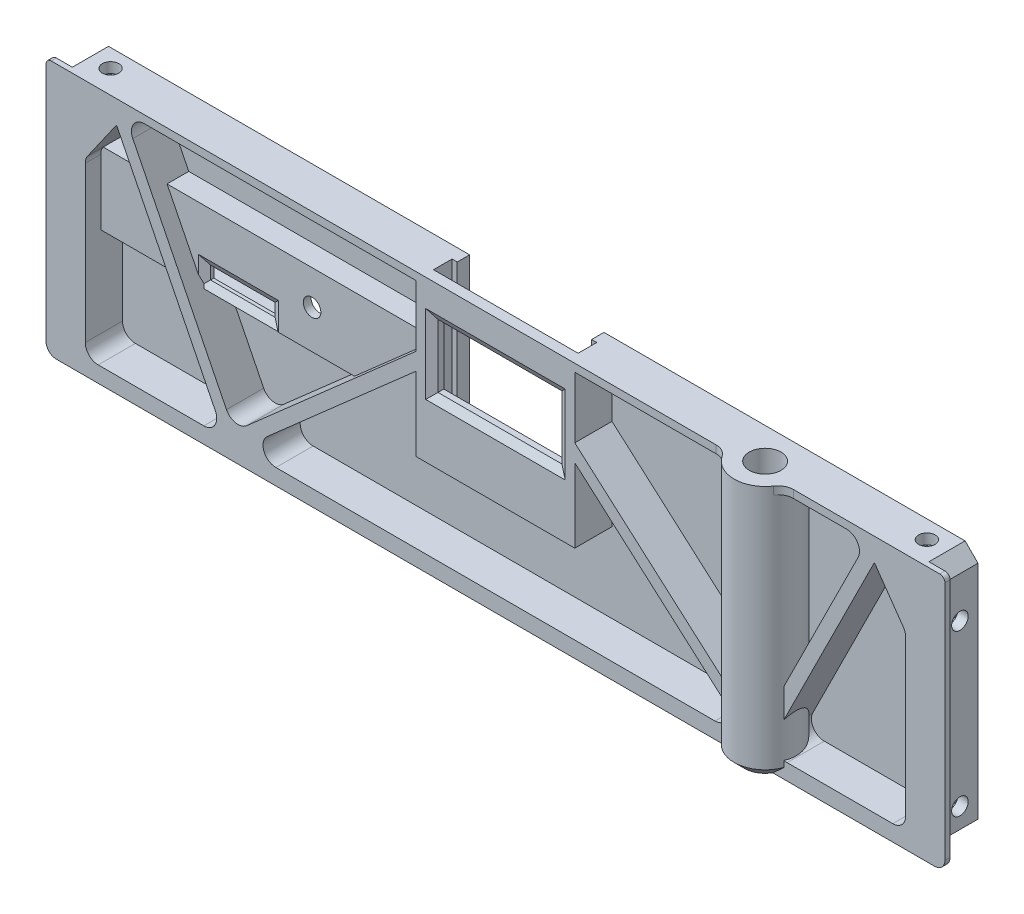
from build123d import *

# Parameters (mm, degrees)
SKETCH1_W                 = 174
SKETCH1_H                 = 51.1
BOSS_EXTRUDE1_DEPTH       = 8
SKETCH2_OUTSIDE_W         = 212.304
SKETCH2_OUTSIDE_H         = 89.404
SKETCH2_OUTSIDE_W_2       = 170.8
SKETCH2_OUTSIDE_H_2       = 47.9
CUT_EXTRUDE1_DEPTH        = 7
CHAMFER1_SIZE             = 2.5
FILLET1_R                 = 2
SKETCH3_W                 = 158.8
SKETCH3_H                 = 44.9
CUT_EXTRUDE2_DEPTH        = 7.2
BOSS_EXTRUDE2_DEPTH       = 7.2
F_3_0MM_DOWEL_HOLE1_D     = 3.2
F_3_0MM_DOWEL_HOLE1_DEPTH = 5
F_3_0MM_DOWEL_HOLE2_D     = 3.2
F_3_0MM_DOWEL_HOLE2_DEPTH = 5
CUT_EXTRUDE3_START        = -2
SKETCH10_W                = 6.25
SKETCH10_H                = 5.5
CUT_EXTRUDE3_DEPTH        = 1.8
CUT_EXTRUDE4_START        = -2
SKETCH11_W                = 5.5
SKETCH11_H                = 6.25
CUT_EXTRUDE4_DEPTH        = 1.8
BOSS_EXTRUDE3_DEPTH       = 7.2
SMALL_FIX_DEPTH           = 7.2
FILLET2_R                 = 2.5
FILLET3_R                 = 0.1
SKETCH14_W                = 30.7
SKETCH14_H                = 31
BOSS_EXTRUDE4_DEPTH       = 8
SKETCH17_W                = 28
SKETCH17_H                = 3.6
CUT_EXTRUDE6_DEPTH        = 29.5
SKETCH18_W                = 26
SKETCH18_H                = 26.5
CUT_EXTRUDE7_DEPTH        = 6
SKETCH19_W                = 24
SKETCH19_H                = 12.25
CUT_EXTRUDE8_DEPTH        = 2
CHAMFER2_SIZE             = 1.5
CHAMFER2_SIZE2            = 0.866025404
SKETCH21_W                = 174
SKETCH21_H                = 1.6
CUT_EXTRUDE10_DEPTH       = 91.94395252
BOSS_EXTRUDE5_START       = -3
BOSS_EXTRUDE5_DEPTH       = 4.2
SKETCH23_W                = 59
SKETCH23_H                = 9.6
CUT_EXTRUDE11_DEPTH       = 3.5
SKETCH25_W                = 35
SKETCH25_H                = 2.5
CUT_EXTRUDE12_DEPTH       = 3.5
SKETCH26_W                = 5
SKETCH26_H                = 7.4
SKETCH26_W_2              = 7
BOSS_EXTRUDE6_DEPTH       = 3.5
SKETCH27_R                = 1.7
SKETCH27_W                = 12.5
SKETCH27_H                = 2.5
CUT_EXTRUDE13_DEPTH       = 1.5
FILLET4_R                 = 1
BOSS_EXTRUDE8_REACH       = 102.415
SKETCH29_R                = 6
SKETCH30_R                = 3.075
CUT_EXTRUDE14_DEPTH       = 43.9
SKETCH31_W                = 12
SKETCH31_H                = 7
CUT_EXTRUDE15_DEPTH       = 1.6
CHAMFER3_SIZE             = 2
FILLET5_R                 = 3
SKETCH32_W                = 5.5
SKETCH32_H                = 1.8
SKETCH32_W_2              = 1.8
SKETCH32_H_2              = 5.5
CUT_EXTRUDE17_DEPTH       = 0.1


with BuildPart() as part:
    # Sketch1 → Boss-Extrude1 (new body)
    with BuildSketch(Plane.XY):
        Rectangle(SKETCH1_W, SKETCH1_H)
    extrude(amount=-BOSS_EXTRUDE1_DEPTH)

    # Sketch2 outside → Cut-Extrude1 (cut)
    with BuildSketch(Plane(origin=(0, 0, -8), x_dir=(-1, 0, 0), z_dir=(0, 0, -1))):
        Rectangle(SKETCH2_OUTSIDE_W, SKETCH2_OUTSIDE_H)
        Rectangle(SKETCH2_OUTSIDE_W_2, SKETCH2_OUTSIDE_H_2, mode=Mode.SUBTRACT)
    extrude(amount=-CUT_EXTRUDE1_DEPTH, mode=Mode.SUBTRACT)

    # Chamfer1
    chamfer1_edges = [part.edges().sort_by_distance(p)[0] for p in [
        (85.4, -23.95, -4.5),
        (85.4, 23.95, -4.5),
        (-85.4, 23.95, -4.5),
        (-85.4, -23.95, -4.5),
    ]]
    chamfer(chamfer1_edges, length=CHAMFER1_SIZE)

    # Fillet1
    fillet1_edges = [part.edges().sort_by_distance(p)[0] for p in [
        (-87, -25.55, -0.5),
        (87, -25.55, -0.5),
    ]]
    fillet(fillet1_edges, radius=FILLET1_R)

    # Sketch3 → Cut-Extrude2 (cut)
    with BuildSketch(Plane.XY):
        Rectangle(SKETCH3_W, SKETCH3_H)
    extrude(amount=-CUT_EXTRUDE2_DEPTH, mode=Mode.SUBTRACT)

    # Sketch9 → Boss-Extrude2 (add)
    with BuildSketch(Plane.XY):
        Polygon((-73.4, 22.45), (-73.4, 19.45), (-79.4, 10.88111196), (-79.4, 22.45), align=None)
    boss_extrude2 = extrude(amount=-BOSS_EXTRUDE2_DEPTH)

    # Ø3.0mm Dowel Hole1
    with Locations(Plane.ZY.offset(85.4)):
        with Locations((-4.5, 13.55), (-4.5, -17.55)):
            f_3_0mm_dowel_hole1 = Hole(F_3_0MM_DOWEL_HOLE1_D / 2, depth=F_3_0MM_DOWEL_HOLE1_DEPTH)

    # Ø3.0mm Dowel Hole2
    with Locations(Plane(origin=(0, 23.95, 0), x_dir=(1, 0, 0), z_dir=(0, 1, 0))):
        with Locations((-79, 4.5)):
            f_3_0mm_dowel_hole2 = Hole(F_3_0MM_DOWEL_HOLE2_D / 2, depth=F_3_0MM_DOWEL_HOLE2_DEPTH)

    # Sketch10 → Cut-Extrude3 (cut)
    with BuildSketch(Plane.ZY.offset(85.4).offset(CUT_EXTRUDE3_START)):
        with Locations((-4.875, 13.55)):
            Rectangle(SKETCH10_W, SKETCH10_H)
        with Locations((-4.875, -17.55)):
            Rectangle(SKETCH10_W, SKETCH10_H)
    cut_extrude3 = extrude(amount=-CUT_EXTRUDE3_DEPTH, mode=Mode.SUBTRACT)

    # Sketch11 → Cut-Extrude4 (cut)
    with BuildSketch(Plane(origin=(0, 23.95, 0), x_dir=(1, 0, 0), z_dir=(0, 1, 0)).offset(CUT_EXTRUDE4_START)):
        with Locations((-79, 4.875)):
            Rectangle(SKETCH11_W, SKETCH11_H)
    cut_extrude4 = extrude(amount=-CUT_EXTRUDE4_DEPTH, mode=Mode.SUBTRACT)

    # Mirror1: Boss-Extrude2, Ø3.0mm Dowel Hole1, Ø3.0mm Dowel Hole2, Cut-Extrude3, Cut-Extrude4 across plane
    add(boss_extrude2.mirror(Plane(origin=(0, 0, 0), x_dir=(0, 0, 1), z_dir=(1, 0, 0))))
    add(f_3_0mm_dowel_hole1.mirror(Plane(origin=(0, 0, 0), x_dir=(0, 0, 1), z_dir=(1, 0, 0))), mode=Mode.SUBTRACT)
    add(f_3_0mm_dowel_hole2.mirror(Plane(origin=(0, 0, 0), x_dir=(0, 0, 1), z_dir=(1, 0, 0))), mode=Mode.SUBTRACT)
    add(cut_extrude3.mirror(Plane(origin=(0, 0, 0), x_dir=(0, 0, 1), z_dir=(1, 0, 0))), mode=Mode.SUBTRACT)
    add(cut_extrude4.mirror(Plane(origin=(0, 0, 0), x_dir=(0, 0, 1), z_dir=(1, 0, 0))), mode=Mode.SUBTRACT)

    # Sketch12 → Boss-Extrude3 (add)
    with BuildSketch(Plane.XY.offset(-7.2)):
        with BuildLine():
            Line((-74.518667952, 21.892252734), (-51.987365652, -23.298548404))
            ThreePointArc((-51.987365652, -23.298548404), (-51.284500977, -23.83373188), (-50.431737416, -23.603006041))
            Line((-50.431737416, -23.603006041), (0, 20.784788617))
            Line((0, 20.784788617), (50.431737416, -23.603006041))
            ThreePointArc((50.431737416, -23.603006041), (51.284500977, -23.83373188), (51.987365652, -23.298548404))
            Line((51.987365652, -23.298548404), (74.518667952, 21.892252734))
            ThreePointArc((74.518667952, 21.892252734), (73.957747266, 23.568667952), (72.281332048, 23.007747266))
            Line((72.281332048, 23.007747266), (50.619958341, -20.438247045))
            Line((50.619958341, -20.438247045), (0.660693874, 23.533697727))
            ThreePointArc((0.660693874, 23.533697727), (0, 23.783042277), (-0.660693874, 23.533697727))
            Line((-0.660693874, 23.533697727), (-50.619958341, -20.438247045))
            Line((-50.619958341, -20.438247045), (-72.281332048, 23.007747266))
            ThreePointArc((-72.281332048, 23.007747266), (-73.957747266, 23.568667952), (-74.518667952, 21.892252734))
        make_face()
    extrude(amount=BOSS_EXTRUDE3_DEPTH)

    # Sketch13 → Small Fix (add)
    with BuildSketch(Plane.XY):
        Polygon((-73.4, 19.45), (-73.4, 19.648551935), (-73.301005657, 19.45), align=None)
        Polygon((73.301005657, 19.45), (73.4, 19.45), (73.4, 19.648551935), align=None)
    extrude(amount=-SMALL_FIX_DEPTH)

    # Fillet2
    fillet2_edges = [part.edges().sort_by_distance(p)[0] for p in [
        (-79.4, 10.88111196, -3.6),
        (79.4, 10.88111196, -3.6),
        (49.121735458, -22.45, -3.6),
        (-49.121735458, -22.45, -3.6),
        (72.003249519, 22.45, -3.6),
        (1.89195034, 22.45, -3.6),
        (50.619958341, -20.438247045, -3.6),
        (-1.89195034, 22.45, -3.6),
        (-72.003249519, 22.45, -3.6),
        (-50.619958341, -20.438247045, -3.6),
        (0, 20.784788617, -3.6),
        (-52.410436279, -22.45, -3.6),
        (52.410436279, -22.45, -3.6),
        (-79.4, -22.45, -3.6),
        (79.4, -22.45, -3.6),
    ]]
    fillet(fillet2_edges, radius=FILLET2_R)

    # Fillet3
    # the kernel refuses this fillet: 0.1 mm, written as the material it adds along each edge
    with BuildSketch(Plane(origin=(73.4, 19.45, 0), x_dir=(-1, 0, 0), z_dir=(0, 0, -1))) as fillet3_piece_1:
        with BuildLine():
            CenterArc((FILLET3_R * 0.520567050552, -FILLET3_R), FILLET3_R, 90, 55)
            Line((-FILLET3_R * 0.298584993737, -FILLET3_R * 0.426423563649), (0, 0))
            Line((0, 0), (FILLET3_R * 0.520567050552, 0))
        make_face()
    extrude(amount=7.330141763)
    with BuildSketch(Plane(origin=(73.301005657, 19.45, 0), x_dir=(-0.44619781310983325, -0.8949343616020129, 0), z_dir=(0, 0, -1))) as fillet3_piece_2:
        with BuildLine():
            CenterArc((FILLET3_R * 0.618818776719, -FILLET3_R), FILLET3_R, 90, 63.5)
            Line((-FILLET3_R * 0.276115584883, -FILLET3_R * 0.55380218689), (0, 0))
            Line((0, 0), (FILLET3_R * 0.618818776719, 0))
        make_face()
    extrude(amount=7.354704694)
    with BuildSketch(Plane(origin=(-73.301005657, 19.45, 0), x_dir=(0.4461978131097644, -0.8949343616020471, 0), z_dir=(0, 0, -1))) as fillet3_piece_3:
        with BuildLine():
            CenterArc((FILLET3_R * 0.618818776719, FILLET3_R), FILLET3_R, 206.5, 63.5)
            Line((-FILLET3_R * 0.276115584883, FILLET3_R * 0.55380218689), (0, 0))
            Line((0, 0), (FILLET3_R * 0.618818776719, 0))
        make_face()
    extrude(amount=7.354704694)
    with BuildSketch(Plane(origin=(-73.4, 19.45, 0), x_dir=(1, 0, 0), z_dir=(0, 0, -1))) as fillet3_piece_4:
        with BuildLine():
            CenterArc((FILLET3_R * 0.520567050552, FILLET3_R), FILLET3_R, 215, 55)
            Line((-FILLET3_R * 0.298584993737, FILLET3_R * 0.426423563649), (0, 0))
            Line((0, 0), (FILLET3_R * 0.520567050552, 0))
        make_face()
    extrude(amount=7.330141763)

    # Sketch14 → Boss-Extrude4 (add)
    with BuildSketch(Plane(origin=(0, 0, -8), x_dir=(-1, 0, 0), z_dir=(0, 0, -1))):
        with Locations((0, 8.45)):
            Rectangle(SKETCH14_W, SKETCH14_H)
    extrude(amount=-BOSS_EXTRUDE4_DEPTH)

    # Sketch17 → Cut-Extrude6 (cut)
    with BuildSketch(Plane(origin=(0, 23.95, 0), x_dir=(1, 0, 0), z_dir=(0, 1, 0))):
        with Locations((0, 3.8)):
            Rectangle(SKETCH17_W, SKETCH17_H)
    extrude(amount=-CUT_EXTRUDE6_DEPTH, mode=Mode.SUBTRACT)

    # Sketch18 → Cut-Extrude7 (cut)
    with BuildSketch(Plane(origin=(0, 0, -8), x_dir=(-1, 0, 0), z_dir=(0, 0, -1))):
        with Locations((0, 10.7)):
            Rectangle(SKETCH18_W, SKETCH18_H)
    extrude(amount=-CUT_EXTRUDE7_DEPTH, mode=Mode.SUBTRACT)

    # Sketch19 → Cut-Extrude8 (cut)
    with BuildSketch(Plane.XY):
        with Locations((0, 11.075)):
            Rectangle(SKETCH19_W, SKETCH19_H)
    extrude(amount=-CUT_EXTRUDE8_DEPTH, mode=Mode.SUBTRACT)

    # Chamfer2
    chamfer2_edges = [part.edges().sort_by_distance(p)[0] for p in [
        (-12, 11.075, 0),
        (0, 4.95, 0),
        (12, 11.075, 0),
        (0, 17.2, 0),
    ]]
    chamfer2_side = [part.faces().sort_by_distance(p)[0] for p in [
        (0, 1.106366133, 0),
    ]]
    chamfer(chamfer2_edges, length=CHAMFER2_SIZE, length2=CHAMFER2_SIZE2, reference=chamfer2_side[0])

    # Sketch21 → Cut-Extrude10 (cut, through all)
    with BuildSketch(Plane(origin=(0, 0, -1), x_dir=(-1, 0, 0), z_dir=(0, 0, -1))):
        with Locations((0, 24.75)):
            Rectangle(SKETCH21_W, SKETCH21_H)
    extrude(amount=-CUT_EXTRUDE10_DEPTH, mode=Mode.SUBTRACT)

    # Sketch22 → Boss-Extrude5 (add)
    with BuildSketch(Plane.XY.offset(BOSS_EXTRUDE5_START)):
        Polygon((-79.4, -2.55), (-30.296007021, -2.55), (-15.35, 10.604817276), (-15.35, 11.55), (-23.6, 11.55), (-79.4, 11.55), align=None)
    extrude(amount=-BOSS_EXTRUDE5_DEPTH)

    # Sketch23 → Cut-Extrude11 (cut)
    with BuildSketch(Plane(origin=(0, 0, -8), x_dir=(-1, 0, 0), z_dir=(0, 0, -1))):
        with Locations((53.6, 5.75)):
            Rectangle(SKETCH23_W, SKETCH23_H)
    extrude(amount=-CUT_EXTRUDE11_DEPTH, mode=Mode.SUBTRACT)

    # Sketch25 → Cut-Extrude12 (cut)
    with BuildSketch(Plane(origin=(0, 0, -8), x_dir=(-1, 0, 0), z_dir=(0, 0, -1))):
        with Locations((49.6, -0.3)):
            Rectangle(SKETCH25_W, SKETCH25_H)
    extrude(amount=-CUT_EXTRUDE12_DEPTH, mode=Mode.SUBTRACT)

    # Sketch26 → Boss-Extrude6 (add)
    with BuildSketch(Plane(origin=(0, 0, -8), x_dir=(-1, 0, 0), z_dir=(0, 0, -1))):
        with Locations((26.6, 6.85)):
            Rectangle(SKETCH26_W, SKETCH26_H)
        with Locations((79.6, 6.85)):
            Rectangle(SKETCH26_W_2, SKETCH26_H)
    extrude(amount=-BOSS_EXTRUDE6_DEPTH)

    # Sketch27 → Cut-Extrude13 (cut)
    with BuildSketch(Plane.XY.offset(-3)):
        with Locations((-38.5000075, 4.9)):
            Circle(SKETCH27_R)
        with Locations((-52.773699, 0.035)):
            Rectangle(SKETCH27_W, SKETCH27_H)
    extrude(amount=-CUT_EXTRUDE13_DEPTH, mode=Mode.SUBTRACT)

    # Fillet4
    fillet4_edges = [part.edges().sort_by_distance(p)[0] for p in [
        (87, 23.95, -0.5),
        (-87, 23.95, -0.5),
    ]]
    fillet(fillet4_edges, radius=FILLET4_R)

    # Boss-Extrude8: up to this face of the body (flat: up to its plane)
    boss_extrude8_end = Plane(part.part.faces().sort_by_distance((0, -25.55, -0.5))[0])
    # Sketch29 → Boss-Extrude8 (add, up to the picked face)
    with BuildSketch(Plane(origin=(0, 23.95, 0), x_dir=(1, 0, 0), z_dir=(0, 1, 0)), mode=Mode.PRIVATE) as boss_extrude8_sk1:
        with Locations((50.194998341, 2)):
            Circle(SKETCH29_R)
    boss_extrude8_tool1 = split(extrude(boss_extrude8_sk1.sketch, amount=-BOSS_EXTRUDE8_REACH, mode=Mode.PRIVATE), bisect_by=boss_extrude8_end, keep=Keep.BOTH, mode=Mode.PRIVATE)
    add(boss_extrude8_tool1.solids().sort_by(Axis((50.194998, 23.95, -2), (0, -1, 0)))[0])

    # Sketch30 → Cut-Extrude14 (cut)
    with BuildSketch(Plane(origin=(0, 23.95, 0), x_dir=(1, 0, 0), z_dir=(0, 1, 0))):
        with Locations(Location((50.194998341, 2, 0), (0, 0, 270))):
            Circle(SKETCH30_R)
    extrude(amount=-CUT_EXTRUDE14_DEPTH, mode=Mode.SUBTRACT)

    # Sketch31 → Cut-Extrude15 (cut)
    with BuildSketch(Plane.XZ.offset(23.95)):
        with Locations((50.194998341, -4.5)):
            Rectangle(SKETCH31_W, SKETCH31_H)
    extrude(amount=CUT_EXTRUDE15_DEPTH, mode=Mode.SUBTRACT)

    # Chamfer3
    chamfer3_edges = [part.edges().sort_by_distance(p)[0] for p in [
        (50.194998341, -25.55, 4),
    ]]
    chamfer(chamfer3_edges, length=CHAMFER3_SIZE)

    # Fillet5
    fillet5_edges = [part.edges().sort_by_distance(p)[0] for p in [
        (55.85185259, 23.2, 0),
        (44.538144091, 23.2, 0),
    ]]
    fillet(fillet5_edges, radius=FILLET5_R)

    # Sketch32 → Cut-Extrude17 (cut)
    with BuildSketch(Plane(origin=(0, 0, -1.75), x_dir=(-1, 0, 0), z_dir=(0, 0, -1))):
        with Locations((-79, 21.05)):
            Rectangle(SKETCH32_W, SKETCH32_H)
        with Locations((-82.5, 13.55)):
            Rectangle(SKETCH32_W_2, SKETCH32_H_2)
        with Locations((-82.5, -17.55)):
            Rectangle(SKETCH32_W_2, SKETCH32_H_2)
        with Locations((79, 21.05)):
            Rectangle(SKETCH32_W, SKETCH32_H)
        with Locations((82.5, 13.55)):
            Rectangle(SKETCH32_W_2, SKETCH32_H_2)
        with Locations((82.5, -17.55)):
            Rectangle(SKETCH32_W_2, SKETCH32_H_2)
    extrude(amount=-CUT_EXTRUDE17_DEPTH, mode=Mode.SUBTRACT)

    # Chamfer4
    # the kernel refuses this chamfer: 1.5, 0.866025404 mm, written as the material it takes off along each edge
    with BuildSketch(Plane(origin=(-59.023699, -1.215, -3), x_dir=(-0.999813220622208, 0, 0.01932676561270085), z_dir=(0, 1, 0))) as chamfer4_piece_1_section:
        with BuildLine():
            Line((1.552251453, 0), (-0.069269092, -0.894853797))
            Line((-0.069269092, -0.894853797), (-0.099263488, -0.894273994))
            ThreePointArc((-0.099263488, -0.894273994), (-0.038653033, -0.447349219), (-0.029994397, 0.000579803))
            Line((-0.029994397, 0.000579803), (0.000579803, 0.029994397))
            ThreePointArc((0.000579803, 0.029994397), (0.776415628, 0.014997198), (1.552831256, 0.029994397))
            Line((1.552831256, 0.029994397), (1.552251453, 0))
        make_face()
    chamfer4_piece_1 = extrude(amount=2.5, mode=Mode.PRIVATE)
    chamfer4_piece_1 = split(chamfer4_piece_1, bisect_by=Plane(origin=(-60.570298803, -0.480951586, -3.279645617), z_dir=(0.8949343616020278, 0.4461978131098034, 0)), keep=Keep.TOP, mode=Mode.PRIVATE)
    add(chamfer4_piece_1, mode=Mode.SUBTRACT)
    with BuildSketch(Plane(origin=(-46.523699, -1.215, -3), x_dir=(0, -0.9998132206222078, 0.01932676561270086), z_dir=(-1, 0, 0)), Plane(origin=(-59.023699, 1.285, -3), x_dir=(0, 0.9998132206222078, 0.019326765612700865), z_dir=(1, 0, 0))) as chamfer4_piece_2:
        with BuildLine():
            Line((1.552251453, 0), (-0.069269092, -0.894853797))
            Line((-0.069269092, -0.894853797), (-0.099263488, -0.894273994))
            ThreePointArc((-0.099263488, -0.894273994), (-0.038653033, -0.447349219), (-0.029994397, 0.000579803))
            Line((-0.029994397, 0.000579803), (0.000579803, 0.029994397))
            ThreePointArc((0.000579803, 0.029994397), (0.776415628, 0.014997198), (1.552831256, 0.029994397))
            Line((1.552831256, 0.029994397), (1.552251453, 0))
        make_face()
    extrude(amount=12.5, mode=Mode.SUBTRACT)
    with BuildSketch(Plane(origin=(-46.523699, 1.285, -3), x_dir=(0.999813220622208, 0, 0.01932676561270085), z_dir=(0, -1, 0))) as chamfer4_piece_3:
        with BuildLine():
            Line((1.552251453, 0), (-0.069269092, -0.894853797))
            Line((-0.069269092, -0.894853797), (-0.099263488, -0.894273994))
            ThreePointArc((-0.099263488, -0.894273994), (-0.038653033, -0.447349219), (-0.029994397, 0.000579803))
            Line((-0.029994397, 0.000579803), (0.000579803, 0.029994397))
            ThreePointArc((0.000579803, 0.029994397), (0.776415628, 0.014997198), (1.552831256, 0.029994397))
            Line((1.552831256, 0.029994397), (1.552251453, 0))
        make_face()
    extrude(amount=2.5, mode=Mode.SUBTRACT)
    with BuildSketch(Plane(origin=(-59.023699, -5.095628632, -3), x_dir=(-0.999813220622208, 0, 0.01932676561270085), z_dir=(0, 1, 0))) as chamfer4_piece_4a_section:
        with BuildLine():
            Line((1.552251453, 0), (-0.069269092, -0.894853797))
            Line((-0.069269092, -0.894853797), (-0.099263488, -0.894273994))
            ThreePointArc((-0.099263488, -0.894273994), (-0.038653033, -0.447349219), (-0.029994397, 0.000579803))
            Line((-0.029994397, 0.000579803), (0.000579803, 0.029994397))
            ThreePointArc((0.000579803, 0.029994397), (0.776415628, 0.014997198), (1.552831256, 0.029994397))
            Line((1.552831256, 0.029994397), (1.552251453, 0))
        make_face()
    chamfer4_piece_4a = extrude(amount=6.380628632, mode=Mode.PRIVATE)
    chamfer4_piece_4a = split(chamfer4_piece_4a, bisect_by=Plane(origin=(-59.6754058, -2.275829273, -3.341830743), z_dir=(0.8949343616020278, 0.4461978131098034, 0)), keep=Keep.TOP, mode=Mode.PRIVATE)
    chamfer4_piece_4a = split(chamfer4_piece_4a, bisect_by=Plane(origin=(-59.322131996, -1.215, -3.341830743), z_dir=(0, -1, 0)), keep=Keep.TOP, mode=Mode.PRIVATE)
    with BuildSketch(Plane(origin=(-46.523699, -1.215, -3), x_dir=(0, -0.9998132206222078, 0.01932676561270086), z_dir=(-1, 0, 0))) as chamfer4_piece_4b_section:
        with BuildLine():
            Line((1.552251453, 0), (-0.069269092, -0.894853797))
            Line((-0.069269092, -0.894853797), (-0.099263488, -0.894273994))
            ThreePointArc((-0.099263488, -0.894273994), (-0.038653033, -0.447349219), (-0.029994397, 0.000579803))
            Line((-0.029994397, 0.000579803), (0.000579803, 0.029994397))
            ThreePointArc((0.000579803, 0.029994397), (0.776415628, 0.014997198), (1.552831256, 0.029994397))
            Line((1.552831256, 0.029994397), (1.552251453, 0))
        make_face()
    chamfer4_piece_4b = extrude(amount=16.380628632, mode=Mode.PRIVATE)
    chamfer4_piece_4b = split(chamfer4_piece_4b, bisect_by=Plane(origin=(-59.896635862, -1.832110413, -3.30259577), z_dir=(0.8949343616020278, 0.4461978131098034, 0)), keep=Keep.TOP, mode=Mode.PRIVATE)
    chamfer4_piece_4b = split(chamfer4_piece_4b, bisect_by=Plane(origin=(-59.023699, -1.638552895, -3.30259577), z_dir=(-1, 0, 0)), keep=Keep.TOP, mode=Mode.PRIVATE)
    chamfer4_piece_4 = chamfer4_piece_4a & chamfer4_piece_4b
    add(chamfer4_piece_4, mode=Mode.SUBTRACT)
    with BuildSketch(Plane(origin=(-59.023699, -1.215, -3), x_dir=(-0.999813220622208, 0, 0.01932676561270085), z_dir=(0, 1, 0))) as chamfer4_piece_5a_section:
        with BuildLine():
            Line((1.552251453, 0), (-0.069269092, -0.894853797))
            Line((-0.069269092, -0.894853797), (-0.099263488, -0.894273994))
            ThreePointArc((-0.099263488, -0.894273994), (-0.038653033, -0.447349219), (-0.029994397, 0.000579803))
            Line((-0.029994397, 0.000579803), (0.000579803, 0.029994397))
            ThreePointArc((0.000579803, 0.029994397), (0.776415628, 0.014997198), (1.552831256, 0.029994397))
            Line((1.552831256, 0.029994397), (1.552251453, 0))
        make_face()
    chamfer4_piece_5a = extrude(amount=6.380628632, mode=Mode.PRIVATE)
    chamfer4_piece_5a = split(chamfer4_piece_5a, bisect_by=Plane(origin=(-59.526772407, 1.285, -3.277708275), z_dir=(0, 1, 0)), keep=Keep.TOP, mode=Mode.PRIVATE)
    with BuildSketch(Plane(origin=(-62.904327632, 1.285, -3), x_dir=(0, 0.9998132206222078, 0.019326765612700865), z_dir=(1, 0, 0))) as chamfer4_piece_5b_section:
        with BuildLine():
            Line((1.552251453, 0), (-0.069269092, -0.894853797))
            Line((-0.069269092, -0.894853797), (-0.099263488, -0.894273994))
            ThreePointArc((-0.099263488, -0.894273994), (-0.038653033, -0.447349219), (-0.029994397, 0.000579803))
            Line((-0.029994397, 0.000579803), (0.000579803, 0.029994397))
            ThreePointArc((0.000579803, 0.029994397), (0.776415628, 0.014997198), (1.552831256, 0.029994397))
            Line((1.552831256, 0.029994397), (1.552251453, 0))
        make_face()
    chamfer4_piece_5b = extrude(amount=16.380628632, mode=Mode.PRIVATE)
    chamfer4_piece_5b = split(chamfer4_piece_5b, bisect_by=Plane(origin=(-61.44741432, 1.27826998, -3.269067069), z_dir=(0.8949343616020278, 0.4461978131098034, 0)), keep=Keep.TOP, mode=Mode.PRIVATE)
    chamfer4_piece_5b = split(chamfer4_piece_5b, bisect_by=Plane(origin=(-59.023699, 1.815683786, -3.269067069), z_dir=(-1, 0, 0)), keep=Keep.TOP, mode=Mode.PRIVATE)
    chamfer4_piece_5 = chamfer4_piece_5a & chamfer4_piece_5b
    add(chamfer4_piece_5, mode=Mode.SUBTRACT)
    with BuildSketch(Plane(origin=(-42.643070368, -1.215, -3), x_dir=(0, -0.9998132206222078, 0.019326765612700865), z_dir=(-1, 0, 0))) as chamfer4_piece_6a_section:
        with BuildLine():
            Line((1.552251453, 0), (-0.069269092, -0.894853797))
            Line((-0.069269092, -0.894853797), (-0.099263488, -0.894273994))
            ThreePointArc((-0.099263488, -0.894273994), (-0.038653033, -0.447349219), (-0.029994397, 0.000579803))
            Line((-0.029994397, 0.000579803), (0.000579803, 0.029994397))
            ThreePointArc((0.000579803, 0.029994397), (0.776415628, 0.014997198), (1.552831256, 0.029994397))
            Line((1.552831256, 0.029994397), (1.552251453, 0))
        make_face()
    chamfer4_piece_6a = extrude(amount=16.380628632, mode=Mode.PRIVATE)
    chamfer4_piece_6a = split(chamfer4_piece_6a, bisect_by=Plane(origin=(-46.523699, -1.718073407, -3.277708275), z_dir=(1, 0, 0)), keep=Keep.TOP, mode=Mode.PRIVATE)
    with BuildSketch(Plane(origin=(-46.523699, 1.285, -3), x_dir=(0.999813220622208, 0, 0.01932676561270085), z_dir=(0, -1, 0))) as chamfer4_piece_6b_section:
        with BuildLine():
            Line((1.552251453, 0), (-0.069269092, -0.894853797))
            Line((-0.069269092, -0.894853797), (-0.099263488, -0.894273994))
            ThreePointArc((-0.099263488, -0.894273994), (-0.038653033, -0.447349219), (-0.029994397, 0.000579803))
            Line((-0.029994397, 0.000579803), (0.000579803, 0.029994397))
            ThreePointArc((0.000579803, 0.029994397), (0.776415628, 0.014997198), (1.552831256, 0.029994397))
            Line((1.552831256, 0.029994397), (1.552251453, 0))
        make_face()
    chamfer4_piece_6b = extrude(amount=6.380628632, mode=Mode.PRIVATE)
    chamfer4_piece_6b = split(chamfer4_piece_6b, bisect_by=Plane(origin=(-46.020625593, -1.215, -3.277708275), z_dir=(0, -1, 0)), keep=Keep.TOP, mode=Mode.PRIVATE)
    chamfer4_piece_6 = chamfer4_piece_6a & chamfer4_piece_6b
    add(chamfer4_piece_6, mode=Mode.SUBTRACT)
    with BuildSketch(Plane(origin=(-46.523699, 5.165628632, -3), x_dir=(0.999813220622208, 0, 0.01932676561270085), z_dir=(0, -1, 0))) as chamfer4_piece_7a_section:
        with BuildLine():
            Line((1.552251453, 0), (-0.069269092, -0.894853797))
            Line((-0.069269092, -0.894853797), (-0.099263488, -0.894273994))
            ThreePointArc((-0.099263488, -0.894273994), (-0.038653033, -0.447349219), (-0.029994397, 0.000579803))
            Line((-0.029994397, 0.000579803), (0.000579803, 0.029994397))
            ThreePointArc((0.000579803, 0.029994397), (0.776415628, 0.014997198), (1.552831256, 0.029994397))
            Line((1.552831256, 0.029994397), (1.552251453, 0))
        make_face()
    chamfer4_piece_7a = extrude(amount=6.380628632, mode=Mode.PRIVATE)
    chamfer4_piece_7a = split(chamfer4_piece_7a, bisect_by=Plane(origin=(-46.020625593, 1.285, -3.277708275), z_dir=(0, 1, 0)), keep=Keep.TOP, mode=Mode.PRIVATE)
    with BuildSketch(Plane(origin=(-59.023699, 1.285, -3), x_dir=(0, 0.9998132206222078, 0.019326765612700865), z_dir=(1, 0, 0))) as chamfer4_piece_7b_section:
        with BuildLine():
            Line((1.552251453, 0), (-0.069269092, -0.894853797))
            Line((-0.069269092, -0.894853797), (-0.099263488, -0.894273994))
            ThreePointArc((-0.099263488, -0.894273994), (-0.038653033, -0.447349219), (-0.029994397, 0.000579803))
            Line((-0.029994397, 0.000579803), (0.000579803, 0.029994397))
            ThreePointArc((0.000579803, 0.029994397), (0.776415628, 0.014997198), (1.552831256, 0.029994397))
            Line((1.552831256, 0.029994397), (1.552251453, 0))
        make_face()
    chamfer4_piece_7b = extrude(amount=16.380628632, mode=Mode.PRIVATE)
    chamfer4_piece_7b = split(chamfer4_piece_7b, bisect_by=Plane(origin=(-46.523699, 1.788073407, -3.277708275), z_dir=(1, 0, 0)), keep=Keep.TOP, mode=Mode.PRIVATE)
    chamfer4_piece_7 = chamfer4_piece_7a & chamfer4_piece_7b
    add(chamfer4_piece_7, mode=Mode.SUBTRACT)


solid = part.part
